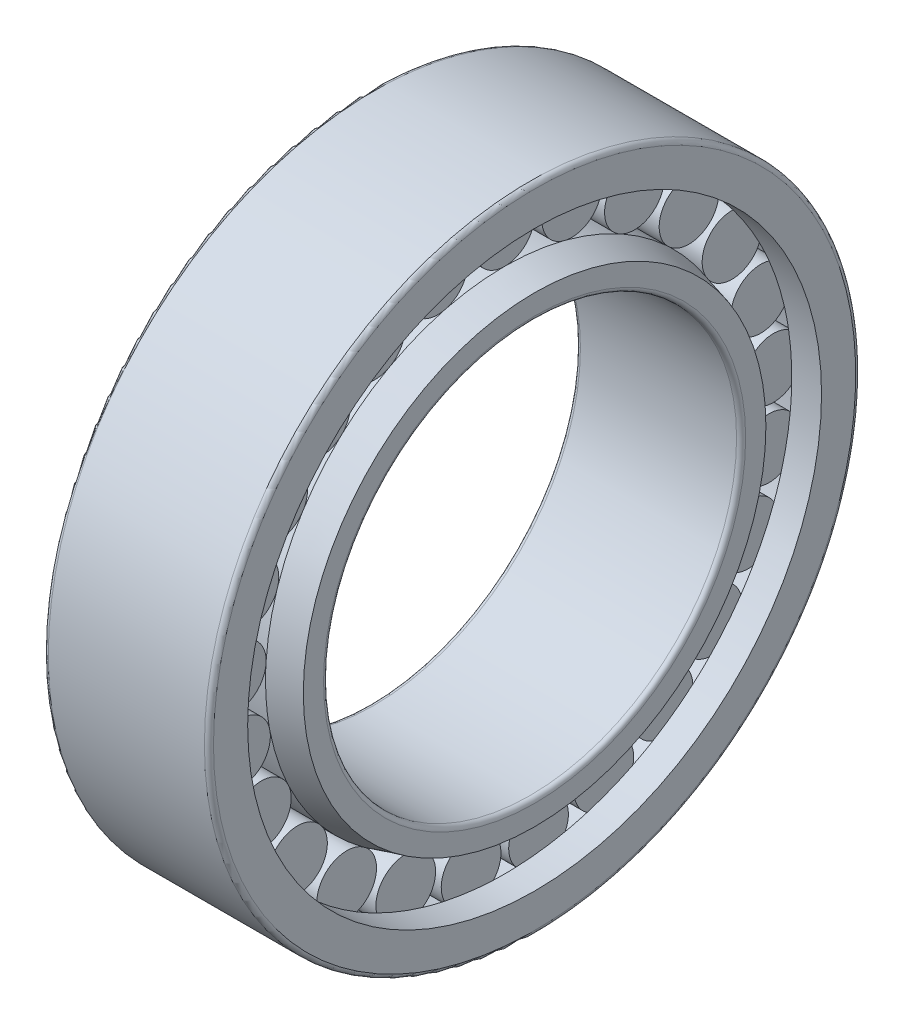
from build123d import *

# Parameters (mm, degrees)
SKETCH2_W               = 7.378821332
SKETCH2_H               = 7.232102096
CIRCULAR_PATTERN1_COUNT = 25


with BuildPart() as part:
    # Sketch1 → Revolve1 (revolve)
    with BuildSketch(Plane.XY):
        with BuildLine():
            Line((12.787897904, 57.933312306), (20, 56.000835373))
            Line((20, 56.000835373), (20, 51.1))
            ThreePointArc((20, 51.1), (19.677817459, 50.322182541), (18.9, 50))
            Line((18.9, 50), (-18.9, 50))
            ThreePointArc((-18.9, 50), (-19.677817459, 50.322182541), (-20, 51.1))
            Line((-20, 51.1), (-20, 56.000835373))
            Line((-20, 56.000835373), (-12.787897904, 57.933312306))
            Line((-12.787897904, 57.933312306), (12.787897904, 57.933312306))
        make_face()
    revolve(axis=Axis((0, 0, 0), (1, 0, 0)))

    # Sketch2 → Revolve2 (revolve)
    with BuildSketch(Plane.XY):
        with Locations((9.098487238, 68.76146545)):
            Rectangle(SKETCH2_W, SKETCH2_H)
        with Locations((-9.098487238, 68.76146545)):
            Rectangle(SKETCH2_W, SKETCH2_H)
    revolve2 = revolve(axis=Axis((5.409076572, 65.145414402, 0), (-1, 0, 0)))

    # Sketch3 → Revolve3 (revolve)
    with BuildSketch(Plane.XY):
        with BuildLine():
            Line((-20, 69.47267566), (-12.787897904, 69.47267566))
            Line((-12.787897904, 69.47267566), (-12.787897904, 72.357516498))
            Line((-12.787897904, 72.357516498), (-5.409076572, 72.357516498))
            Line((-5.409076572, 72.357516498), (-5.409076572, 69.47267566))
            Line((-5.409076572, 69.47267566), (5.409076572, 69.47267566))
            Line((5.409076572, 69.47267566), (5.409076572, 72.357516498))
            Line((5.409076572, 72.357516498), (12.787897904, 72.357516498))
            Line((12.787897904, 72.357516498), (12.787897904, 69.47267566))
            Line((12.787897904, 69.47267566), (20, 69.47267566))
            Line((20, 69.47267566), (20, 77.748408385))
            ThreePointArc((20, 77.748408385), (19.677817459, 78.526225844), (18.9, 78.848408385))
            Line((18.9, 78.848408385), (-18.9, 78.848408385))
            ThreePointArc((-18.9, 78.848408385), (-19.677817459, 78.526225844), (-20, 77.748408385))
            Line((-20, 77.748408385), (-20, 69.47267566))
        make_face()
    revolve(axis=Axis((0, 0, 0), (1, 0, 0)))

    # Circular-Pattern1: Revolve2 ×25 about axis
    circular_pattern1_axis = Axis((0, 0, 0), (1, 0, 0))
    for i in range(1, CIRCULAR_PATTERN1_COUNT):
        add(revolve2.rotate(circular_pattern1_axis, i * 360 / CIRCULAR_PATTERN1_COUNT))


solid = part.part
